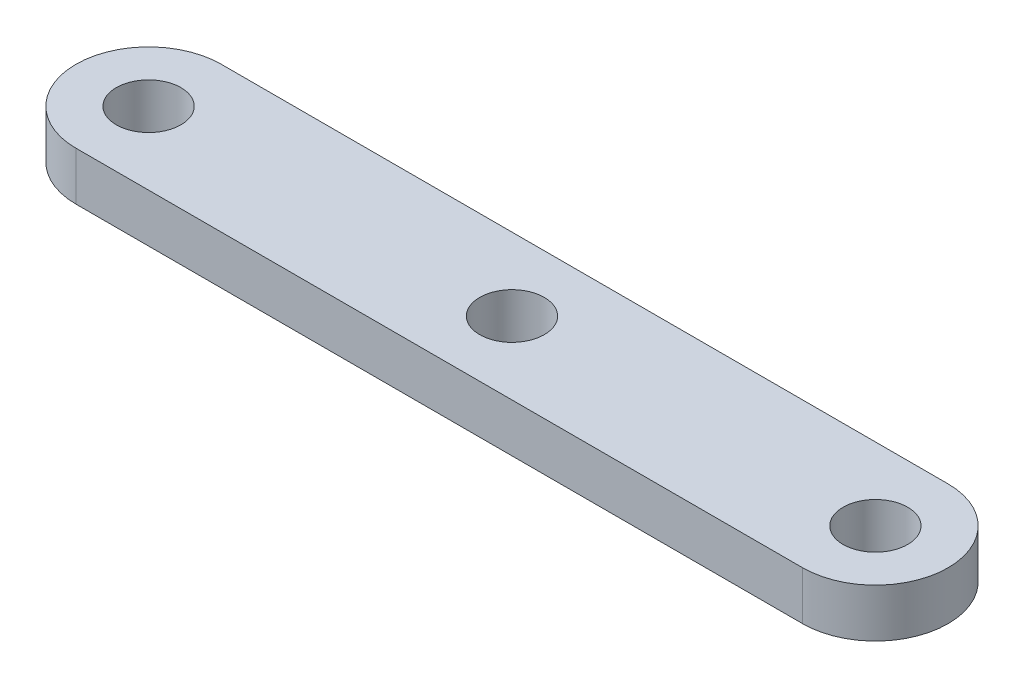
from build123d import *

# Parameters (mm, degrees)
BOSS_EXTRUDE1_DEPTH = 6
SKETCH3_R           = 4
CUT_EXTRUDE1_DEPTH  = 6


with BuildPart() as part:
    # Sketch2 → Boss-Extrude1 (new body)
    with BuildSketch(Plane(origin=(0, 0, 0), x_dir=(1, 0, 0), z_dir=(0, 1, 0))):
        with BuildLine():
            Line((0, 0), (90, 0))
            ThreePointArc((90, 0), (99, 9), (90, 18))
            Line((90, 18), (0, 18))
            ThreePointArc((0, 18), (-9, 9), (0, 0))
        make_face()
    extrude(amount=BOSS_EXTRUDE1_DEPTH)

    # Sketch3 → Cut-Extrude1 (cut)
    with BuildSketch(Plane.XZ):
        with Locations((0, -9)):
            Circle(SKETCH3_R)
        with Locations((90, -9)):
            Circle(SKETCH3_R)
        with Locations((45, -9)):
            Circle(SKETCH3_R)
    extrude(amount=-CUT_EXTRUDE1_DEPTH, mode=Mode.SUBTRACT)


solid = part.part
